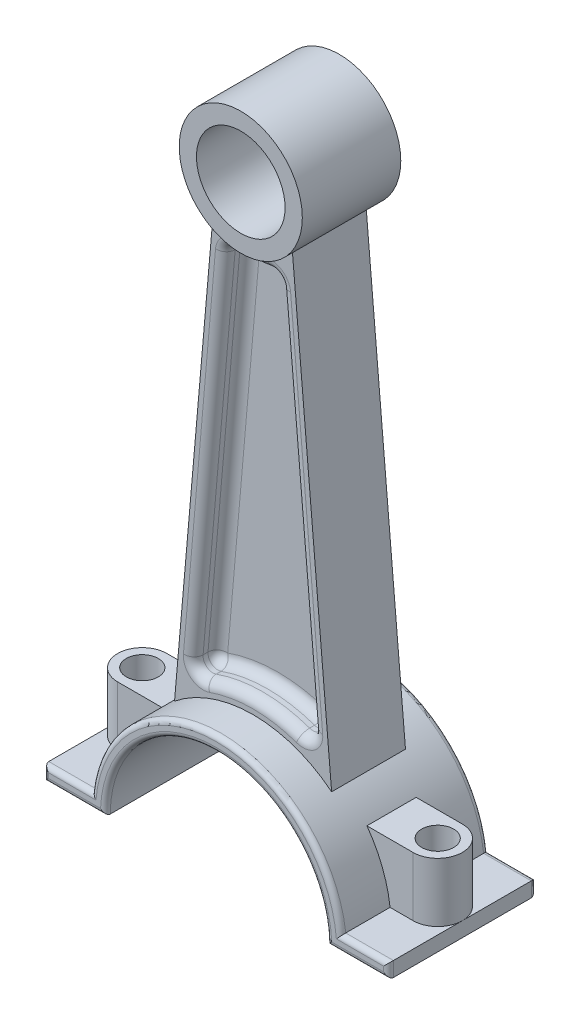
from build123d import *

# Parameters (mm, degrees)
SKETCH1_R           = 12.5
SKETCH1_R_2         = 9
BOSS_EXTRUDE1_DEPTH = 10
BOSS_EXTRUDE2_DEPTH = 15
BOSS_EXTRUDE3_DEPTH = 7.5
CUT_EXTRUDE1_START  = 2.5
CUT_EXTRUDE1_DEPTH  = 132.27810578243563
CUT_EXTRUDE2_START  = 12
CUT_EXTRUDE2_DEPTH  = 148.36620704592414
FILLET1_R           = 2
FILLET2_R           = 1


with BuildPart() as part:
    # Sketch1 → Boss-Extrude1 (new, symmetric)
    with BuildSketch(Plane.XY):
        Circle(SKETCH1_R)
        Circle(SKETCH1_R_2, mode=Mode.SUBTRACT)
    extrude(amount=BOSS_EXTRUDE1_DEPTH, both=True)



with BuildPart() as body_2:
    # Sketch1<4> → Boss-Extrude2 (new, symmetric)
    with BuildSketch(Plane.XY):
        with BuildLine():
            ThreePointArc((15.952867935585882, -100.50638281684911), (8.454666221372882, -96.342389580734), (-3.4017e-13, -94.9))
            Line((1.162e-14, -94.9), (1.199e-14, -97.9))
            ThreePointArc((3.6442e-13, -97.9), (15.909902576697455, -104.49009742330281), (22.500000000000014, -120.4))
            Line((22.500000000000018, -120.4), (35, -120.4))
            Line((35, -120.4), (35, -117.4))
            Line((35, -117.4), (25.322914524201217, -117.4))
            ThreePointArc((25.322914524201213, -117.4), (22.29957689732318, -108.03153727416496), (15.952867935585882, -100.50638281684911))
        make_face()
        with BuildLine():
            Line((1.199e-14, -97.9), (1.162e-14, -94.9))
            ThreePointArc((-3.4017e-13, -94.9), (-8.454666221373191, -96.3423895807341), (-15.95286793558586, -100.50638281684913))
            ThreePointArc((-15.95286793558586, -100.50638281684913), (-22.299576897323156, -108.03153727416496), (-25.32291452420118, -117.4))
            Line((-25.322914524201188, -117.4), (-35, -117.4))
            Line((-35, -117.4), (-35, -120.4))
            Line((-35, -120.4), (-22.49999999999999, -120.4))
            ThreePointArc((-22.499999999999986, -120.4), (-15.909902576697178, -104.49009742330256), (3.6442e-13, -97.9))
        make_face()
    extrude(amount=BOSS_EXTRUDE2_DEPTH, both=True)


with BuildPart() as part_1:
    add(part.part)

    add(body_2.part)  # Boss-Extrude3 merges body 2
    # Sketch1<5> → Boss-Extrude3 (add, symmetric)
    with BuildSketch(Plane.XY):
        with BuildLine():
            Line((1.162e-14, -94.9), (1.53e-15, -12.5))
            ThreePointArc((-3.5757e-13, -12.5), (-4.253905296791234, -11.753905296790998), (-7.999999999999999, -9.604686356149275))
            Line((-7.999999999999998, -9.604686356149276), (-15.95286793558585, -100.50638281684913))
            ThreePointArc((-15.95286793558586, -100.50638281684913), (-8.454666221373191, -96.3423895807341), (-3.4017e-13, -94.9))
        make_face()
        with BuildLine():
            ThreePointArc((7.9999999999999964, -9.604686356149276), (4.2539052967908955, -11.753905296791121), (-3.5757e-13, -12.5))
            Line((1.53e-15, -12.5), (1.162e-14, -94.9))
            ThreePointArc((-3.4017e-13, -94.9), (8.454666221372882, -96.342389580734), (15.952867935585882, -100.50638281684911))
            Line((15.952867935585878, -100.50638281684913), (8.000000000000002, -9.604686356149275))
        make_face()
    extrude(amount=BOSS_EXTRUDE3_DEPTH, both=True)

    # Sketch2 → Cut-Extrude1 (cut)
    with BuildSketch(Plane.XY.offset(CUT_EXTRUDE1_START)):
        with BuildLine():
            Line((12.438451254570163, -94.75755607615214), (5.418745800218238, -14.521955582930875))
            ThreePointArc((5.418745800218238, -14.521955582930875), (9.5e-16, -15.499999999999998), (-5.418745800218232, -14.521955582930875))
            Line((-5.418745800218232, -14.521955582930875), (-12.438451254570134, -94.75755607615213))
            ThreePointArc((-12.438451254570134, -94.75755607615213), (1.649e-14, -91.9), (12.438451254570163, -94.75755607615214))
        make_face()
    cut_extrude1 = extrude(amount=CUT_EXTRUDE1_DEPTH, mode=Mode.SUBTRACT)

    # Mirror1: Cut-Extrude1 across plane
    add(cut_extrude1.mirror(Plane.XY), mode=Mode.SUBTRACT)

    # Boss-Extrude4: read off the stored shape, not the designer's step
    # Boss-Extrude4: loft between two sections, ruled curve by curve
    boss_extrude4_from = [
        Edge.make_three_point_arc((30, -117.4, 5), (33.535533906, -117.4, 3.535533906), (35, -117.4, 0)),
        Edge.make_three_point_arc((35, -117.4, 0), (33.535533906, -117.4, -3.535533906), (30, -117.4, -5)),
        Edge.make_line((30, -117.4, 5), (25.322914524, -117.4, 5)),
        Edge.make_line((30, -117.4, -5), (25.322914524, -117.4, -5)),
        Edge.make_line((25.322914524, -117.4, -5), (25.322914524, -117.4, 5)),
    ]
    boss_extrude4_to = [
        Edge.make_three_point_arc((30, -105.4, 5), (33.535533906, -105.4, 3.535533906), (35, -105.4, 0)),
        Edge.make_three_point_arc((35, -105.4, 0), (33.535533906, -105.4, -3.535533906), (30, -105.4, -5)),
        Edge.make_line((30, -105.4, 5), (20.621590627, -105.4, 5)),
        Edge.make_line((30, -105.4, -5), (20.621590627, -105.4, -5)),
        Edge.make_line((20.621590627, -105.4, -5), (20.621590627, -105.4, 5)),
    ]
    boss_extrude4 = Solid(Shell([*[Face.make_surface_from_curves(boss_extrude4_from[k], boss_extrude4_to[k]) for k in range(5)], Face(Wire(boss_extrude4_from)), Face(Wire(boss_extrude4_to))]))
    add(boss_extrude4)

    # Sketch3<3> → Cut-Extrude2 (cut, through all)
    with BuildSketch(Plane(origin=(0, -117.4, 0), x_dir=(1, 0, 0), z_dir=(0, 1, 0)).offset(CUT_EXTRUDE2_START)):
        with BuildLine():
            ThreePointArc((33.25, 0), (32.29809703885629, 2.2980970388562687), (30.00000000000003, 3.2499999999999973))
            Line((30.000000000000004, 3.2499999999999973), (30.000000000000004, -3.2499999999999973))
            ThreePointArc((30.000000000000032, -3.2499999999999973), (32.29809703885629, -2.298097038856268), (33.25, -8e-16))
        make_face()
        with BuildLine():
            Line((30.000000000000004, -3.2499999999999973), (30.000000000000004, 3.2499999999999973))
            ThreePointArc((30.00000000000003, 3.2499999999999973), (26.750000000000007, -2.49e-15), (30.000000000000032, -3.2499999999999973))
        make_face()
    cut_extrude2 = extrude(amount=-CUT_EXTRUDE2_DEPTH, mode=Mode.SUBTRACT)

    # Mirror2: Boss-Extrude4, Cut-Extrude2 across plane
    add(boss_extrude4.mirror(Plane(origin=(0, 0, 0), x_dir=(0, 0, 1), z_dir=(1, 0, 0))))
    add(cut_extrude2.mirror(Plane(origin=(0, 0, 0), x_dir=(0, 0, 1), z_dir=(1, 0, 0))), mode=Mode.SUBTRACT)

    # Fillet1
    fillet1_edges = [part_1.edges().sort_by_distance(p)[0] for p in [
        (-8.928598527394184, -54.6397558295415, 7.5),
        (2.2e-16, -15.499999999999998, 7.5),
        (8.9285985273942, -54.6397558295415, 7.5),
        (7.99e-15, -91.9, 7.5),
        (-12.438451254570136, -94.75755607615213, 5),
        (1.51e-14, -91.9, 2.5),
        (12.438451254570161, -94.75755607615213, 5),
        (8.9285985273942, -54.63975582954151, 2.5),
        (5.418745800218238, -14.521955582930875, 5),
        (2e-15, -15.499999999999998, 2.5),
        (-5.418745800218234, -14.521955582930875, 5),
        (-8.928598527394183, -54.6397558295415, 2.5),
        (8.9285985273942, -54.63975582954151, -7.5),
        (5.55e-15, -15.499999999999998, -7.5),
        (-8.928598527394184, -54.6397558295415, -7.5),
        (8.9e-16, -91.9, -7.5),
        (12.438451254570161, -94.75755607615213, -5),
        (-12.438451254570136, -94.75755607615213, -5),
        (-5.418745800218234, -14.521955582930875, -5),
        (5.418745800218238, -14.521955582930875, -5),
        (1.51e-14, -91.9, -2.5),
        (8.9285985273942, -54.63975582954151, -2.5),
        (2e-15, -15.499999999999998, -2.5),
        (-8.928598527394183, -54.6397558295415, -2.5),
    ]]
    fillet(fillet1_edges, radius=FILLET1_R)

    # Fillet2
    fillet2_edges = [part_1.edges().sort_by_distance(p)[0] for p in [
        (-3.952e-14, -94.90000000000005, -15),
        (-30.161457262100594, -117.4, 15),
        (-35, -118.9, 15),
        (-28.749999999999993, -120.4, -15),
        (5.82e-15, -97.9, 15),
        (28.750000000000007, -120.4, -15),
        (35, -118.9, -15),
        (30.16145726210061, -117.4, 15),
        (-5.063e-14, -94.89999999999996, 15),
        (-28.749999999999993, -120.4, 15),
        (28.750000000000007, -120.4, 15),
        (35, -118.9, 15),
        (30.16145726210061, -117.4, -15),
        (2.349e-14, -97.9, -15),
        (-35, -118.9, -15),
        (-30.161457262100594, -117.4, -15),
    ]]
    fillet(fillet2_edges, radius=FILLET2_R)


solid = part_1.part
